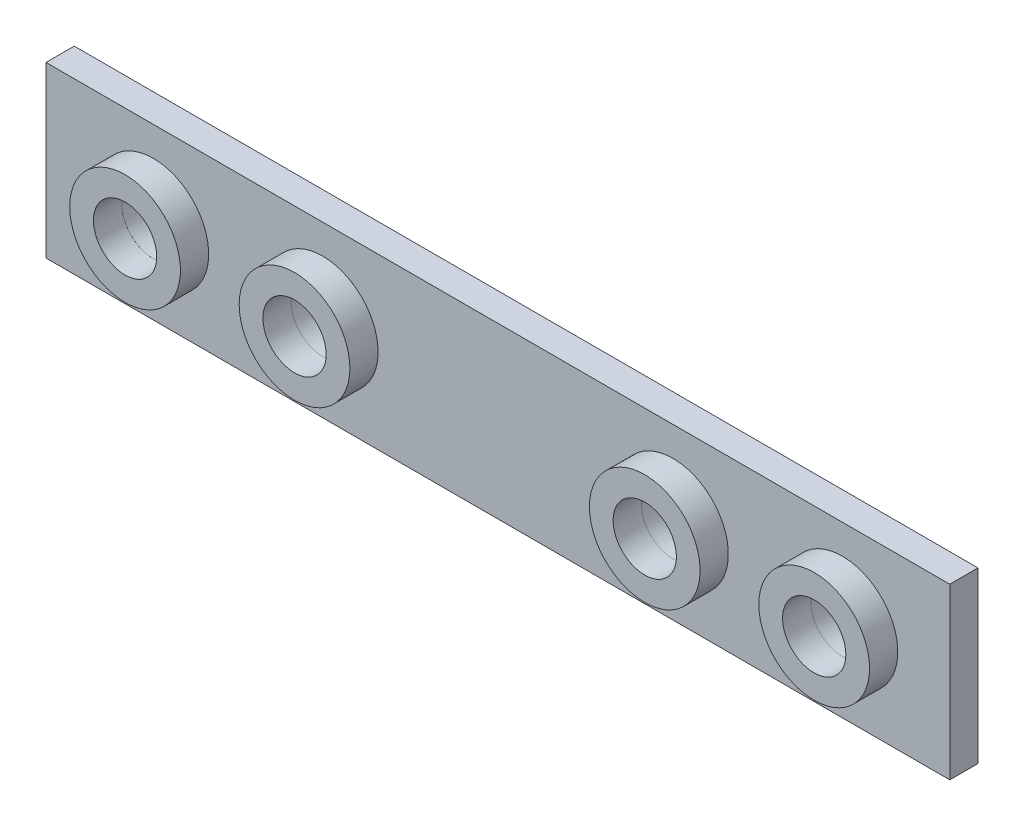
from build123d import *

# Parameters (mm, degrees)
SKETCH1_R             = 4.9
SKETCH1_R_2           = 2.8
BOSS_EXTRUDE1_DEPTH   = 5
BOSS_EXTRUDE1_2_DEPTH = 5
BOSS_EXTRUDE1_3_DEPTH = 5
BOSS_EXTRUDE1_4_DEPTH = 5
SKETCH3_W             = 80
SKETCH3_H             = 15
BOSS_EXTRUDE2_DEPTH   = 2.5
SKETCH4_R             = 2.8
CUT_EXTRUDE1_DEPTH    = 42.003048667


with BuildPart() as part:
    # Sketch1 → Boss-Extrude1 (new body)
    with BuildSketch(Plane.XY):
        with Locations((-15.5, 0)):
            Circle(SKETCH1_R)
        with Locations((-15.5, 0)):
            Circle(SKETCH1_R_2, mode=Mode.SUBTRACT)
    extrude(amount=BOSS_EXTRUDE1_DEPTH)



with BuildPart() as body_2:
    # Sketch1 → Boss-Extrude1 2 (new body)
    with BuildSketch(Plane.XY):
        with Locations((-30.5, 0)):
            Circle(SKETCH1_R)
        with Locations((-30.5, 0)):
            Circle(SKETCH1_R_2, mode=Mode.SUBTRACT)
    extrude(amount=BOSS_EXTRUDE1_2_DEPTH)


with BuildPart() as body_3:
    # Sketch1 → Boss-Extrude1 3 (new body)
    with BuildSketch(Plane.XY):
        with Locations((15.5, 0)):
            Circle(SKETCH1_R)
        with Locations((15.5, 0)):
            Circle(SKETCH1_R_2, mode=Mode.SUBTRACT)
    extrude(amount=BOSS_EXTRUDE1_3_DEPTH)


with BuildPart() as body_4:
    # Sketch1 → Boss-Extrude1 4 (new body)
    with BuildSketch(Plane.XY):
        with Locations((30.5, 0)):
            Circle(SKETCH1_R)
        with Locations((30.5, 0)):
            Circle(SKETCH1_R_2, mode=Mode.SUBTRACT)
    extrude(amount=BOSS_EXTRUDE1_4_DEPTH)


with BuildPart() as part_1:
    add(part.part)

    add(body_2.part)  # Boss-Extrude2 merges body 2

    add(body_3.part)  # Boss-Extrude2 merges body 3

    add(body_4.part)  # Boss-Extrude2 merges body 4
    # Sketch3 → Boss-Extrude2 (add)
    with BuildSketch(Plane.XY):
        Rectangle(SKETCH3_W, SKETCH3_H)
    extrude(amount=BOSS_EXTRUDE2_DEPTH)

    # Sketch4 → Cut-Extrude1 (cut, through all)
    with BuildSketch(Plane.XY.offset(5)):
        with Locations((-30.5, 0)):
            Circle(SKETCH4_R)
        with Locations((-15.5, 0)):
            Circle(SKETCH4_R)
        with Locations((15.5, 0)):
            Circle(SKETCH4_R)
        with Locations((30.5, 0)):
            Circle(SKETCH4_R)
    extrude(amount=-CUT_EXTRUDE1_DEPTH, mode=Mode.SUBTRACT)


with BuildPart() as body_2_2:
    # Split1: the piece on the far side of the plane
    add(part_1.part)
    split(bisect_by=Plane(origin=(0, 0, 2.5), x_dir=(-1, 0, 0), z_dir=(0, 0, -1)), keep=Keep.BOTTOM)


with BuildPart() as part_2:
    add(part_1.part)

    # Split1
    split(bisect_by=Plane(origin=(0, 0, 2.5), x_dir=(-1, 0, 0), z_dir=(0, 0, -1)), keep=Keep.TOP)


solid = Compound([body_2_2.part, part_2.part])
